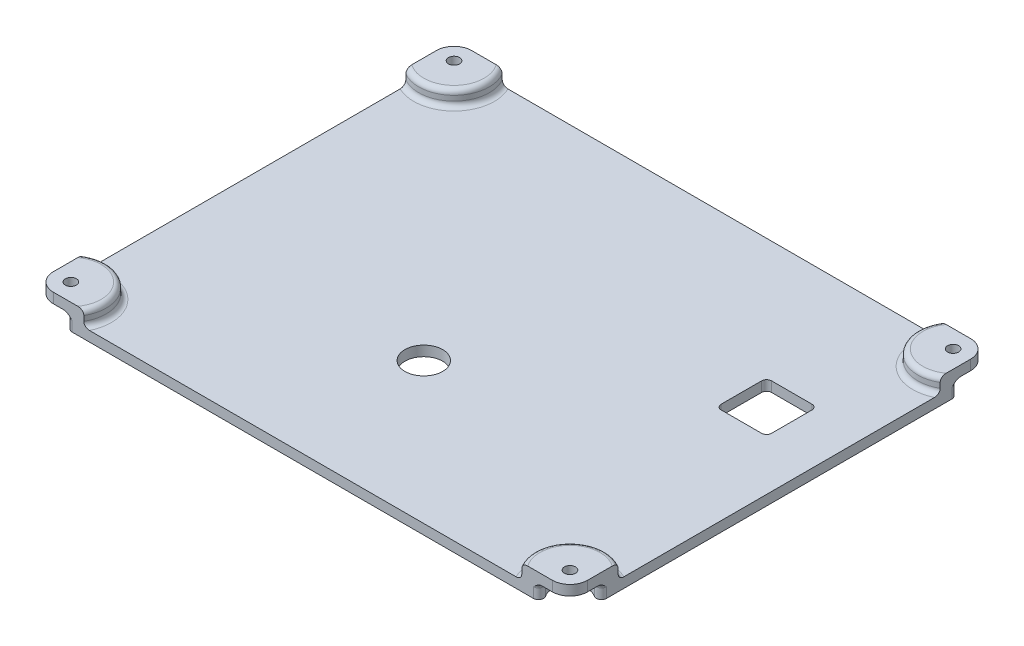
from build123d import *

# Parameters (mm, degrees)
SKETCH_1_R          = 1.1
EXTRUDE_1_DEPTH     = 2
SKETCH_1_3_R        = 3.5
SKETCH_1_3_R_2      = 1.1
EXTRUDE_2_DEPTH     = 5
SKETCH_1_4_R        = 3.5
CUT_EXTRUDE_1_DEPTH = 3
FILLET_START        = -1
FILLET_1_DEPTH      = 4
FILLET_2_R          = 1
FILLET_3_R          = 1
SKETCH_2_R          = 3.75
CUT_EXTRUDE_3_DEPTH = 10
SKETCH_3_W          = 10
SKETCH_3_H          = 10
CUT_EXTRUDE_5_DEPTH = 68.500000147
FILLET_4_R          = 1


with BuildPart() as part:
    # Эскиз1 → Бобышка-Вытянуть1 (new body)
    with BuildSketch(Plane(origin=(0, 0, 0), x_dir=(1, 0, 0), z_dir=(0, 1, 0))):
        with BuildLine():
            ThreePointArc((49.5, -41.5), (51.974873734, -40.474873734), (53, -38))
            Line((53, -38), (53, 38))
            ThreePointArc((53, 38), (51.974873734, 40.474873734), (49.5, 41.5))
            Line((49.5, 41.5), (-49.5, 41.5))
            ThreePointArc((-49.5, 41.5), (-51.974873734, 40.474873734), (-53, 38))
            Line((-53, 38), (-53, -38))
            ThreePointArc((-53, -38), (-51.974873749, -40.47487372), (-49.500000041, -41.5))
            Line((-49.500000041, -41.5), (49.5, -41.5))
        make_face()
        with Locations(Location((49.5, -38, 0), (0, 0, 270))):
            Circle(SKETCH_1_R, mode=Mode.SUBTRACT)
        with Locations(Location((-49.5, -38, 0), (0, 0, 270))):
            Circle(SKETCH_1_R, mode=Mode.SUBTRACT)
        with Locations(Location((49.5, 38, 0), (0, 0, 270))):
            Circle(SKETCH_1_R, mode=Mode.SUBTRACT)
        with Locations(Location((-49.5, 38, 0), (0, 0, 270))):
            Circle(SKETCH_1_R, mode=Mode.SUBTRACT)
    extrude(amount=EXTRUDE_1_DEPTH)

    # Эскиз1<3> → Бобышка-Вытянуть2 (add)
    # profile 1 of 8: a face of its own
    with BuildSketch(Plane(origin=(0, 0, 0), x_dir=(1, 0, 0), z_dir=(0, 1, 0))):
        with BuildLine():
            Line((-53, 38), (-53, 31.937822174))
            ThreePointArc((-53, 31.937822174), (-46, 31.937822174), (-42.5, 38))
            ThreePointArc((-42.5, 38), (-42.738519216, 39.811733316), (-43.437822174, 41.5))
            Line((-43.437822174, 41.5), (-49.5, 41.5))
            ThreePointArc((-49.5, 41.5), (-47.025126266, 40.474873734), (-46, 38))
            ThreePointArc((-46, 38), (-49.5, 34.5), (-53, 38))
        make_face()
    # profile 2 of 8: a face of its own
    with BuildSketch(Plane(origin=(0, 0, 0), x_dir=(1, 0, 0), z_dir=(0, 1, 0))):
        with BuildLine():
            ThreePointArc((43.437822174, 41.5), (44.550252532, 33.050252532), (53, 31.937822174))
            Line((53, 31.937822174), (53, 38))
            ThreePointArc((53, 38), (47.025126266, 35.525126266), (49.5, 41.5))
            Line((49.5, 41.5), (43.437822174, 41.5))
        make_face()
    # profile 3 of 8: a face of its own
    with BuildSketch(Plane(origin=(0, 0, 0), x_dir=(1, 0, 0), z_dir=(0, 1, 0))):
        with Locations((49.5, 38)):
            Circle(SKETCH_1_3_R)
        with Locations(Location((49.5, 38, 0), (0, 0, 270))):
            Circle(SKETCH_1_3_R_2, mode=Mode.SUBTRACT)
    # profile 4 of 8: a face of its own
    with BuildSketch(Plane(origin=(0, 0, 0), x_dir=(1, 0, 0), z_dir=(0, 1, 0))):
        with Locations((49.5, -38)):
            Circle(SKETCH_1_3_R)
        with Locations(Location((49.5, -38, 0), (0, 0, 270))):
            Circle(SKETCH_1_3_R_2, mode=Mode.SUBTRACT)
    # profile 5 of 8: a face of its own
    with BuildSketch(Plane(origin=(0, 0, 0), x_dir=(1, 0, 0), z_dir=(0, 1, 0))):
        with BuildLine():
            Line((43.437822174, -41.5), (49.5, -41.5))
            ThreePointArc((49.5, -41.5), (47.025126266, -35.525126266), (53, -38))
            Line((53, -38), (53, -31.937822174))
            ThreePointArc((53, -31.937822174), (44.550252532, -33.050252532), (43.437822174, -41.5))
        make_face()
    # profile 6 of 8: a face of its own
    with BuildSketch(Plane(origin=(0, 0, 0), x_dir=(1, 0, 0), z_dir=(0, 1, 0))):
        with BuildLine():
            Line((-49.500000041, -41.5), (-43.437822174, -41.5))
            ThreePointArc((-43.437822174, -41.5), (-42.738519216, -39.811733316), (-42.5, -38))
            ThreePointArc((-42.5, -38), (-46, -31.937822174), (-53, -31.937822174))
            Line((-53, -31.937822174), (-53, -38))
            ThreePointArc((-53, -38), (-49.5, -34.5), (-46, -38))
            ThreePointArc((-46, -38), (-47.02512628, -40.474873749), (-49.500000041, -41.5))
        make_face()
    # profile 7 of 8: a face of its own
    with BuildSketch(Plane(origin=(0, 0, 0), x_dir=(1, 0, 0), z_dir=(0, 1, 0))):
        with Locations((-49.5, -38)):
            Circle(SKETCH_1_3_R)
        with Locations(Location((-49.5, -38, 0), (0, 0, 270))):
            Circle(SKETCH_1_3_R_2, mode=Mode.SUBTRACT)
    # profile 8 of 8: a face of its own
    with BuildSketch(Plane(origin=(0, 0, 0), x_dir=(1, 0, 0), z_dir=(0, 1, 0))):
        with Locations((-49.5, 38)):
            Circle(SKETCH_1_3_R)
        with Locations(Location((-49.5, 38, 0), (0, 0, 270))):
            Circle(SKETCH_1_3_R_2, mode=Mode.SUBTRACT)
    extrude(amount=EXTRUDE_2_DEPTH)

    # Эскиз1<4> → Вырез-Вытянуть1 (cut)
    with BuildSketch(Plane(origin=(0, 0, 0), x_dir=(1, 0, 0), z_dir=(0, 1, 0))):
        with Locations((-49.5, 38)):
            Circle(SKETCH_1_4_R)
        with Locations((-49.5, -38)):
            Circle(SKETCH_1_4_R)
        with Locations((49.5, -38)):
            Circle(SKETCH_1_4_R)
        with Locations((49.5, 38)):
            Circle(SKETCH_1_4_R)
    extrude(amount=CUT_EXTRUDE_1_DEPTH, mode=Mode.SUBTRACT)

    # Скругление1: read off the stored shape, not the designer's step
    # Скругление1 outline → Скругление1 (cut)
    with BuildSketch(Plane(origin=(0, 0, 0), x_dir=(1, 0, 0), z_dir=(0, 1, 0)).offset(FILLET_START)):
        with BuildLine():
            Line((49.5, 41.5), (45.758342613, 41.5))
            ThreePointArc((45.758342613, 41.5), (46.640259717, 40.971404521), (46.589822033, 39.944444444))
            ThreePointArc((46.589822033, 39.944444444), (47.850084177, 41.086709863), (49.5, 41.5))
        make_face()
        with BuildLine():
            ThreePointArc((-46.589822033, 39.944444444), (-46.640259717, 40.971404521), (-45.758342613, 41.5))
            Line((-45.758342613, 41.5), (-49.5, 41.5))
            ThreePointArc((-49.5, 41.5), (-47.850084177, 41.086709863), (-46.589822033, 39.944444444))
        make_face()
        with BuildLine():
            ThreePointArc((53, 38), (52.586709863, 36.350084177), (51.444444444, 35.089822033))
            ThreePointArc((51.444444444, 35.089822033), (52.471404521, 35.140259717), (53, 34.258342613))
            Line((53, 34.258342613), (53, 38))
        make_face()
        with BuildLine():
            ThreePointArc((-53, 34.258342613), (-52.471404521, 35.140259717), (-51.444444444, 35.089822033))
            ThreePointArc((-51.444444444, 35.089822033), (-52.586709863, 36.350084177), (-53, 38))
            Line((-53, 38), (-53, 34.258342613))
        make_face()
        with BuildLine():
            Line((53, -38), (53, -34.258342613))
            ThreePointArc((53, -34.258342613), (52.471404521, -35.140259717), (51.444444444, -35.089822033))
            ThreePointArc((51.444444444, -35.089822033), (52.586709863, -36.350084177), (53, -38))
        make_face()
        with BuildLine():
            ThreePointArc((-51.444444444, -35.089822033), (-52.471404521, -35.140259717), (-53, -34.258342613))
            Line((-53, -34.258342613), (-53, -38))
            ThreePointArc((-53, -38), (-52.586709863, -36.350084177), (-51.444444444, -35.089822033))
        make_face()
        with BuildLine():
            ThreePointArc((49.5, -41.5), (47.850084177, -41.086709863), (46.589822033, -39.944444444))
            ThreePointArc((46.589822033, -39.944444444), (46.640259717, -40.971404521), (45.758342613, -41.5))
            Line((45.758342613, -41.5), (49.5, -41.5))
        make_face()
        with BuildLine():
            ThreePointArc((-45.758342613, -41.5), (-46.640259717, -40.971404521), (-46.589822033, -39.944444444))
            ThreePointArc((-46.589822033, -39.944444444), (-47.850084177, -41.086709863), (-49.5, -41.5))
            Line((-49.5, -41.5), (-45.758342613, -41.5))
        make_face()
    extrude(amount=FILLET_1_DEPTH, mode=Mode.SUBTRACT)

    # Скругление2
    fillet_2_edges = [part.edges().sort_by_distance(p)[0] for p in [
        (-44.550252532, 2, -33.050252532),
        (-44.550252532, 5, -33.050252532),
        (44.550252532, 2, -33.050252532),
        (44.550252532, 5, -33.050252532),
        (44.550252532, 2, 33.050252532),
        (44.550252532, 5, 33.050252532),
        (-44.550252532, 2, 33.050252532),
        (-44.550252532, 5, 33.050252532),
    ]]
    fillet(fillet_2_edges, radius=FILLET_2_R)

    # Скругление3
    # the kernel refuses this fillet: 1 mm, written as the material it adds along each edge
    with BuildSketch(Plane(origin=(49.5, 3, -38), x_dir=(-0.8314794192984706, 0, -0.5555555555325482), z_dir=(0.5555555555325482, 0, -0.8314794192984706))) as fillet_3_piece_1:
        with BuildLine():
            CenterArc((3.5 - FILLET_3_R, -FILLET_3_R), FILLET_3_R, 0, 90)
            Line((3.5 - FILLET_3_R, 0), (3.5, 0))
            Line((3.5, 0), (3.5, -FILLET_3_R))
        make_face()
    revolve(axis=Axis((49.5, 3, -38), (0, 1, 0)), revolution_arc=157.497977189)
    with BuildSketch(Plane(origin=(49.5, 3, 38), x_dir=(0.5555555555325482, 0, -0.8314794192984706), z_dir=(0.8314794192984706, 0, 0.5555555555325482))) as fillet_3_piece_2:
        with BuildLine():
            CenterArc((3.5 - FILLET_3_R, -FILLET_3_R), FILLET_3_R, 0, 90)
            Line((3.5 - FILLET_3_R, 0), (3.5, 0))
            Line((3.5, 0), (3.5, -FILLET_3_R))
        make_face()
    revolve(axis=Axis((49.5, 3, 38), (0, 1, 0)), revolution_arc=157.497977189)
    with BuildSketch(Plane(origin=(-49.5, 3, 38), x_dir=(-0.5555555555325417, 0, -0.8314794192984749), z_dir=(-0.8314794192984749, 0, 0.5555555555325417))) as fillet_3_piece_3:
        with BuildLine():
            CenterArc((3.5 - FILLET_3_R, FILLET_3_R), FILLET_3_R, 270, 90)
            Line((3.5, FILLET_3_R), (3.5, 0))
            Line((3.5, 0), (3.5 - FILLET_3_R, 0))
        make_face()
    revolve(axis=Axis((-49.5, 3, 38), (0, -1, 0)), revolution_arc=157.497977189)
    with BuildSketch(Plane(origin=(-49.5, 3, -38), x_dir=(-0.5555555555325417, 0, 0.8314794192984749), z_dir=(-0.8314794192984749, 0, -0.5555555555325417))) as fillet_3_piece_4:
        with BuildLine():
            CenterArc((3.5 - FILLET_3_R, -FILLET_3_R), FILLET_3_R, 0, 90)
            Line((3.5, -FILLET_3_R), (3.5, 0))
            Line((3.5, 0), (3.5 - FILLET_3_R, 0))
        make_face()
    revolve(axis=Axis((-49.5, 3, -38), (0, 1, 0)), revolution_arc=157.497977189)
    with BuildSketch(Plane(origin=(45.758342613, 3, -40.5), x_dir=(-0.596949580090342, 0, 0.802278753819372), z_dir=(0.802278753819372, 0, 0.596949580090342))) as fillet_3_piece_5_section:
        with BuildLine():
            CenterArc((1 + FILLET_3_R, FILLET_3_R), FILLET_3_R, 180, 90)
            Line((1 + FILLET_3_R, 0), (1, 0))
            Line((1, 0), (1, FILLET_3_R))
        make_face()
    fillet_3_piece_5 = revolve(axis=Axis((45.758342613, 3, -40.5), (0, -1, 0)), revolution_arc=267.097250193, mode=Mode.PRIVATE)
    fillet_3_piece_5 = split(fillet_3_piece_5, bisect_by=Plane(origin=(45.758342613, 3, -41.5), z_dir=(0, 0, 1)), keep=Keep.TOP, mode=Mode.PRIVATE)
    add(fillet_3_piece_5)
    with BuildSketch(Plane(origin=(52, 3, -34.258342613), x_dir=(-0.5555555552777314, 0, -0.8314794194687273), z_dir=(-0.8314794194687273, 0, 0.5555555552777314))) as fillet_3_piece_6_section:
        with BuildLine():
            CenterArc((1 + FILLET_3_R, FILLET_3_R), FILLET_3_R, 180, 90)
            Line((1 + FILLET_3_R, 0), (1, 0))
            Line((1, 0), (1, FILLET_3_R))
        make_face()
    fillet_3_piece_6 = revolve(axis=Axis((52, 3, -34.258342613), (0, -1, 0)), revolution_arc=267.097250193, mode=Mode.PRIVATE)
    fillet_3_piece_6 = split(fillet_3_piece_6, bisect_by=Plane(origin=(53, 3, -34.258342613), z_dir=(-1, 0, 0)), keep=Keep.TOP, mode=Mode.PRIVATE)
    add(fillet_3_piece_6)
    with BuildSketch(Plane(origin=(45.758342613, 3, 40.5), x_dir=(0.8314794194687273, 0, -0.5555555552777314), z_dir=(-0.5555555552777314, 0, -0.8314794194687273))) as fillet_3_piece_7_section:
        with BuildLine():
            CenterArc((1 + FILLET_3_R, FILLET_3_R), FILLET_3_R, 180, 90)
            Line((1 + FILLET_3_R, 0), (1, 0))
            Line((1, 0), (1, FILLET_3_R))
        make_face()
    fillet_3_piece_7 = revolve(axis=Axis((45.758342613, 3, 40.5), (0, -1, 0)), revolution_arc=267.097250193, mode=Mode.PRIVATE)
    fillet_3_piece_7 = split(fillet_3_piece_7, bisect_by=Plane(origin=(45.758342613, 3, 41.5), z_dir=(0, 0, -1)), keep=Keep.TOP, mode=Mode.PRIVATE)
    add(fillet_3_piece_7)
    with BuildSketch(Plane(origin=(52, 3, 34.258342613), x_dir=(-0.802278753819372, 0, -0.596949580090342), z_dir=(-0.596949580090342, 0, 0.802278753819372))) as fillet_3_piece_8_section:
        with BuildLine():
            CenterArc((1 + FILLET_3_R, FILLET_3_R), FILLET_3_R, 180, 90)
            Line((1 + FILLET_3_R, 0), (1, 0))
            Line((1, 0), (1, FILLET_3_R))
        make_face()
    fillet_3_piece_8 = revolve(axis=Axis((52, 3, 34.258342613), (0, -1, 0)), revolution_arc=267.097250193, mode=Mode.PRIVATE)
    fillet_3_piece_8 = split(fillet_3_piece_8, bisect_by=Plane(origin=(53, 3, 34.258342613), z_dir=(-1, 0, 0)), keep=Keep.TOP, mode=Mode.PRIVATE)
    add(fillet_3_piece_8)
    with BuildSketch(Plane(origin=(-52, 3, 34.258342613), x_dir=(0.5555555552777314, 0, 0.8314794194687273), z_dir=(0.8314794194687273, 0, -0.5555555552777314))) as fillet_3_piece_9_section:
        with BuildLine():
            CenterArc((1 + FILLET_3_R, FILLET_3_R), FILLET_3_R, 180, 90)
            Line((1, FILLET_3_R), (1, 0))
            Line((1, 0), (1 + FILLET_3_R, 0))
        make_face()
    fillet_3_piece_9 = revolve(axis=Axis((-52, 3, 34.258342613), (0, -1, 0)), revolution_arc=267.097250193, mode=Mode.PRIVATE)
    fillet_3_piece_9 = split(fillet_3_piece_9, bisect_by=Plane(origin=(-53, 3, 34.258342613), z_dir=(1, 0, 0)), keep=Keep.TOP, mode=Mode.PRIVATE)
    add(fillet_3_piece_9)
    with BuildSketch(Plane(origin=(-45.758342613, 3, 40.5), x_dir=(0.596949580090342, 0, -0.802278753819372), z_dir=(-0.802278753819372, 0, -0.596949580090342))) as fillet_3_piece_10_section:
        with BuildLine():
            CenterArc((1 + FILLET_3_R, FILLET_3_R), FILLET_3_R, 180, 90)
            Line((1, FILLET_3_R), (1, 0))
            Line((1, 0), (1 + FILLET_3_R, 0))
        make_face()
    fillet_3_piece_10 = revolve(axis=Axis((-45.758342613, 3, 40.5), (0, -1, 0)), revolution_arc=267.097250193, mode=Mode.PRIVATE)
    fillet_3_piece_10 = split(fillet_3_piece_10, bisect_by=Plane(origin=(-45.758342613, 3, 41.5), z_dir=(0, 0, -1)), keep=Keep.TOP, mode=Mode.PRIVATE)
    add(fillet_3_piece_10)
    with BuildSketch(Plane(origin=(-45.758342613, 3, -40.5), x_dir=(-0.8314794194687273, 0, 0.5555555552777314), z_dir=(0.5555555552777314, 0, 0.8314794194687273))) as fillet_3_piece_11_section:
        with BuildLine():
            CenterArc((1 + FILLET_3_R, FILLET_3_R), FILLET_3_R, 180, 90)
            Line((1, FILLET_3_R), (1, 0))
            Line((1, 0), (1 + FILLET_3_R, 0))
        make_face()
    fillet_3_piece_11 = revolve(axis=Axis((-45.758342613, 3, -40.5), (0, -1, 0)), revolution_arc=267.097250193, mode=Mode.PRIVATE)
    fillet_3_piece_11 = split(fillet_3_piece_11, bisect_by=Plane(origin=(-45.758342613, 3, -41.5), z_dir=(0, 0, 1)), keep=Keep.TOP, mode=Mode.PRIVATE)
    add(fillet_3_piece_11)
    with BuildSketch(Plane(origin=(-52, 3, -34.258342613), x_dir=(0.802278753819372, 0, 0.596949580090342), z_dir=(0.596949580090342, 0, -0.802278753819372))) as fillet_3_piece_12_section:
        with BuildLine():
            CenterArc((1 + FILLET_3_R, FILLET_3_R), FILLET_3_R, 180, 90)
            Line((1 + FILLET_3_R, 0), (1, 0))
            Line((1, 0), (1, FILLET_3_R))
        make_face()
    fillet_3_piece_12 = revolve(axis=Axis((-52, 3, -34.258342613), (0, -1, 0)), revolution_arc=267.097250193, mode=Mode.PRIVATE)
    fillet_3_piece_12 = split(fillet_3_piece_12, bisect_by=Plane(origin=(-53, 3, -34.258342613), z_dir=(1, 0, 0)), keep=Keep.TOP, mode=Mode.PRIVATE)
    add(fillet_3_piece_12)

    # Эскиз2 → Вырез-Вытянуть3 (cut)
    with BuildSketch(Plane(origin=(0, 0, 0), x_dir=(1, 0, 0), z_dir=(0, 1, 0))):
        with Locations(Location((-4, -13.5, 0), (0, 0, 270))):
            Circle(SKETCH_2_R)
    extrude(amount=CUT_EXTRUDE_3_DEPTH, mode=Mode.SUBTRACT)

    # Эскиз3 → Вырез-Вытянуть5 (cut, through all)
    with BuildSketch(Plane(origin=(0, 0, 0), x_dir=(1, 0, 0), z_dir=(0, 1, 0))):
        with Locations((38, 12.5)):
            Rectangle(SKETCH_3_W, SKETCH_3_H)
    extrude(amount=CUT_EXTRUDE_5_DEPTH, mode=Mode.SUBTRACT)

    # Скругление4
    fillet_4_edges = [part.edges().sort_by_distance(p)[0] for p in [
        (33, 1, -17.5),
        (33, 1, -7.5),
        (43, 1, -7.5),
        (43, 1, -17.5),
    ]]
    fillet(fillet_4_edges, radius=FILLET_4_R)


solid = part.part
